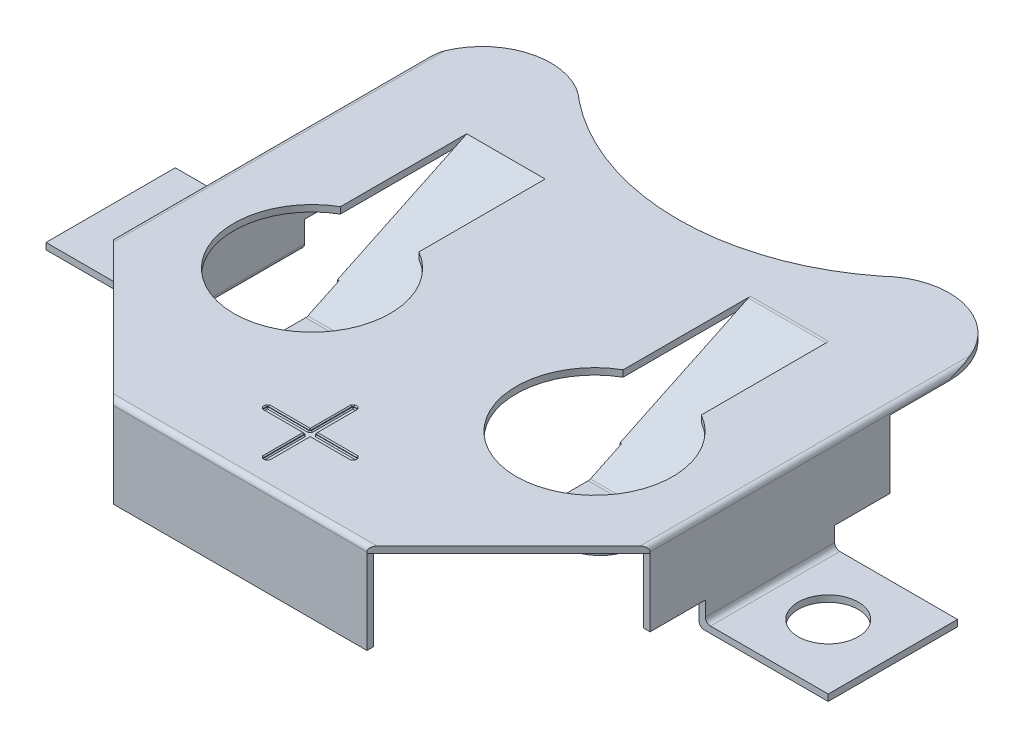
from build123d import *

# Parameters (mm, degrees)
SKETCH1_W        = 5.08
SKETCH1_H        = 5.08
EXTRUDE1_DEPTH   = 0.254
EXTRUDE1_2_DEPTH = 0.254
SKETCH2_R        = 1.1811
EXTRUDE2_DEPTH   = 16.577573784
SKETCH3_W        = 0.254
SKETCH3_H        = 5.08
EXTRUDE3_DEPTH   = 0.7874
SKETCH4_W        = 0.254
SKETCH4_H        = 9.4234
EXTRUDE4_DEPTH   = 2.667
EXTRUDE5_DEPTH   = 0.254
EXTRUDE6_DEPTH   = 0.254
SKETCH7_W        = 9.9568
SKETCH7_H        = 0.254
EXTRUDE7_DEPTH   = 3.302
EXTRUDE8_DEPTH   = 3.0734
EXTRUDE9_START   = -0.254
EXTRUDE9_DEPTH   = 0.859147632
FILLET1_R        = 0.2
FILLET2_R        = 0.2
FILLET3_R        = 0.2
FILLET4_R        = 0.2
FILLET5_R        = 0.2
FILLET6_R        = 0.2
FILLET7_R        = 0.2
FILLET8_R        = 0.2
FILLET9_R        = 0.2
FILLET10_R       = 0.2
FILLET11_R       = 0.2
FILLET12_R       = 0.2
FILLET13_R       = 0.2
FILLET14_R       = 0.2
FILLET15_R       = 0.2
FILLET16_R       = 0.2
FILLET17_R       = 0.2
SKETCH13_W       = 0.2032
SKETCH13_H       = 3.556
SKETCH13_W_2     = 3.556
SKETCH13_H_2     = 0.2032
EXTRUDE10_DEPTH  = 0.1016
CHAMFER1_SIZE    = 0.04


# Read off the part's stored shape, not the designer's step: Extrude9
with BuildPart() as part:
    # Sketch1 → Extrude1 (new body)
    with BuildSketch(Plane(origin=(0, 0, 0), x_dir=(1, 0, 0), z_dir=(0, 1, 0))):
        with Locations((12.827, 0)):
            Rectangle(SKETCH1_W, SKETCH1_H)
    extrude(amount=EXTRUDE1_DEPTH)


with BuildPart() as body_2:
    # Sketch1 → Extrude1 2 (new body)
    with BuildSketch(Plane(origin=(0, 0, 0), x_dir=(1, 0, 0), z_dir=(0, 1, 0))):
        with Locations((-12.827, 0)):
            Rectangle(SKETCH1_W, SKETCH1_H)
    extrude(amount=EXTRUDE1_2_DEPTH)


with BuildPart() as extrude2_tool:
    # Sketch2 → Extrude2 (new, through all)
    with BuildSketch(Plane(origin=(0, 0.254, 0), x_dir=(1, 0, 0), z_dir=(0, 1, 0))):
        with Locations(Location((-12.827, 0, 0), (0, 0, 270))):
            Circle(SKETCH2_R)
        with Locations(Location((12.827, 0, 0), (0, 0, 270))):
            Circle(SKETCH2_R)
    extrude(amount=-EXTRUDE2_DEPTH)


with BuildPart() as part_1:
    add(part.part)

    # Extrude2: cut by extrude2_tool
    add(extrude2_tool.part, mode=Mode.SUBTRACT)



with BuildPart() as body_2_1:
    add(body_2.part)

    # Extrude2: cut by extrude2_tool
    add(extrude2_tool.part, mode=Mode.SUBTRACT)


with BuildPart() as part_2:
    add(part_1.part)

    add(body_2_1.part)  # Extrude3 merges body 2
    # Sketch3 → Extrude3 (add)
    with BuildSketch(Plane(origin=(0, 0.254, 0), x_dir=(1, 0, 0), z_dir=(0, 1, 0))):
        with Locations((-10.414, 0)):
            Rectangle(SKETCH3_W, SKETCH3_H)
        with Locations((10.414, 0)):
            Rectangle(SKETCH3_W, SKETCH3_H)
    extrude(amount=EXTRUDE3_DEPTH)

    # Sketch4 → Extrude4 (add)
    with BuildSketch(Plane(origin=(0, 1.0414, 0), x_dir=(1, 0, 0), z_dir=(0, 1, 0))):
        with Locations((-10.414, 0)):
            Rectangle(SKETCH4_W, SKETCH4_H)
        with Locations((10.414, 0)):
            Rectangle(SKETCH4_W, SKETCH4_H)
    extrude(amount=EXTRUDE4_DEPTH)

    # Sketch5 → Extrude5 (add)
    with BuildSketch(Plane(origin=(0, 3.7084, 0), x_dir=(1, 0, 0), z_dir=(0, 1, 0))):
        with BuildLine():
            Line((-10.541, -4.7117), (-4.9784, -10.2743))
            Line((-4.9784, -10.2743), (4.9784, -10.2743))
            Line((4.9784, -10.2743), (10.541, -4.7117))
            Line((10.541, -4.7117), (10.541, 4.7117))
            Line((10.541, 4.7117), (10.541, 7.081366221))
            ThreePointArc((10.541, 7.081366221), (8.856342037, 9.567471015), (5.904093545, 9.017))
            ThreePointArc((5.904093545, 9.017), (-0.032453227, 6.952785457), (-5.969, 9.017))
            ThreePointArc((-5.969, 9.017), (-8.82572303, 9.595573505), (-10.541, 7.239))
            Line((-10.541, 7.239), (-10.541, 4.7117))
            Line((-10.541, 4.7117), (-10.541, -4.7117))
        make_face()
    extrude(amount=EXTRUDE5_DEPTH)

    # Sketch6 → Extrude6 (cut)
    with BuildSketch(Plane(origin=(0, 3.9624, 0), x_dir=(1, 0, 0), z_dir=(0, 1, 0))):
        with BuildLine():
            Line((-4.0099, 0.754734491), (-4.0099, 5.715))
            Line((-4.0099, 5.715), (-7.0899, 5.715))
            Line((-7.0899, 5.715), (-7.0899, 0.754734491))
            ThreePointArc((-7.0899, 0.754734491), (-5.5499, -4.9784), (-4.0099, 0.754734491))
        make_face()
        with BuildLine():
            Line((7.0866, 5.715), (4.0132, 5.715))
            Line((4.0132, 5.715), (4.0132, 0.756642476))
            ThreePointArc((4.0132, 0.756642476), (5.5499, -4.9784), (7.0866, 0.756642476))
            Line((7.0866, 0.756642476), (7.0866, 5.715))
        make_face()
    extrude(amount=-EXTRUDE6_DEPTH, mode=Mode.SUBTRACT)

    # Sketch7 → Extrude7 (add)
    with BuildSketch(Plane.XZ.offset(-3.7084)):
        with Locations((0, 10.1473)):
            Rectangle(SKETCH7_W, SKETCH7_H)
    extrude(amount=EXTRUDE7_DEPTH)

    # Sketch8 → Extrude8 (add)
    with BuildSketch(Plane(origin=(4.0132, 0, 0), x_dir=(0, 0, -1), z_dir=(1, 0, 0))):
        Polygon((5.715, 3.730661842), (-0.635, 0.682661842), (-3.175, 0.682661842), (-3.175, 0.936661842), (-0.635, 0.936661842), (5.715, 3.9624), align=None)
    extrude8 = extrude(amount=EXTRUDE8_DEPTH)

    # Extrude9 outline → Extrude9 (cut)
    with BuildSketch(Plane(origin=(0, 0.936661842, 0), x_dir=(1, 0, 0), z_dir=(0, 1, 0)).offset(EXTRUDE9_START)):
        with BuildLine():
            Line((4.0132, -3.175), (5.5499, -3.175))
            ThreePointArc((5.5499, -3.175), (4.577375162, -2.813672812), (4.0767, -1.905))
            Line((4.0767, -1.905), (4.0767, 0.635))
            Line((4.0767, 0.635), (4.0132, 0.635))
            Line((4.0132, 0.635), (4.0132, -3.175))
        make_face()
        with BuildLine():
            Line((7.0231, 0.635), (7.0231, -1.905))
            ThreePointArc((7.0231, -1.905), (6.522424838, -2.813672812), (5.5499, -3.175))
            Line((5.5499, -3.175), (7.0866, -3.175))
            Line((7.0866, -3.175), (7.0866, 0.635))
            Line((7.0866, 0.635), (7.0231, 0.635))
        make_face()
    extrude9 = extrude(amount=EXTRUDE9_DEPTH, mode=Mode.SUBTRACT)

    # Mirror1: Extrude8 across plane
    add(extrude8.mirror(Plane(origin=(0, 0, 0), x_dir=(0, 0, 1), z_dir=(1, 0, 0))))

    # Mirror2: Extrude9 across plane
    add(extrude9.mirror(Plane(origin=(0, 0, 0), x_dir=(0, 0, 1), z_dir=(1, 0, 0))), mode=Mode.SUBTRACT)

    # Fillet1
    fillet1_edges = [part_2.edges().sort_by_distance(p)[0] for p in [
        (-10.287, 3.7084, 0),
    ]]
    fillet(fillet1_edges, radius=FILLET1_R)

    # Fillet2
    fillet2_edges = [part_2.edges().sort_by_distance(p)[0] for p in [
        (-5.5499, 0.682661842, 0.635),
    ]]
    fillet(fillet2_edges, radius=FILLET2_R)

    # Fillet3
    fillet3_edges = [part_2.edges().sort_by_distance(p)[0] for p in [
        (-5.5499, 0.936661842, 0.635),
    ]]
    fillet(fillet3_edges, radius=FILLET3_R)

    # Fillet4
    fillet4_edges = [part_2.edges().sort_by_distance(p)[0] for p in [
        (5.5499, 0.682661842, 0.635),
    ]]
    fillet(fillet4_edges, radius=FILLET4_R)

    # Fillet5
    fillet5_edges = [part_2.edges().sort_by_distance(p)[0] for p in [
        (5.5499, 0.936661842, 0.635),
    ]]
    fillet(fillet5_edges, radius=FILLET5_R)

    # Fillet6
    fillet6_edges = [part_2.edges().sort_by_distance(p)[0] for p in [
        (0, 3.7084, 10.0203),
    ]]
    fillet(fillet6_edges, radius=FILLET6_R)

    # Fillet7
    # the kernel refuses this fillet: 0.2 mm, written as the material it takes off along each edge
    with BuildSketch(Plane(origin=(-4.0099, 3.7084, -5.715), x_dir=(0, 0, -1), z_dir=(-1, 0, 0))) as fillet7_piece_1_section:
        with BuildLine():
            CenterArc((FILLET7_R, -FILLET7_R), FILLET7_R, 90, 90)
            Line((0, -FILLET7_R), (0, 0))
            Line((0, 0), (FILLET7_R, 0))
        make_face()
    fillet7_piece_1 = extrude(amount=3.08, mode=Mode.PRIVATE)
    fillet7_piece_1 = split(fillet7_piece_1, bisect_by=Plane(origin=(-4.01155, 3.756367286, -5.768553009), z_dir=(0, -0.9015230574682735, -0.43273106758477137)), keep=Keep.TOP, mode=Mode.PRIVATE)
    fillet7_piece_1 = split(fillet7_piece_1, bisect_by=Plane(origin=(-4.0132, 3.723171149, -5.784487155), z_dir=(1, 0, 0)), keep=Keep.TOP, mode=Mode.PRIVATE)
    add(fillet7_piece_1, mode=Mode.SUBTRACT)
    with BuildSketch(Plane(origin=(-4.0099, 3.7084, -5.715), x_dir=(0, 0, -1), z_dir=(-1, 0, 0))) as fillet7_piece_2_section:
        with BuildLine():
            CenterArc((FILLET7_R, -FILLET7_R), FILLET7_R, 90, 90)
            Line((0, -FILLET7_R), (0, 0))
            Line((0, 0), (FILLET7_R, 0))
        make_face()
    fillet7_piece_2 = extrude(amount=3.08, mode=Mode.PRIVATE)
    fillet7_piece_2 = split(fillet7_piece_2, bisect_by=Plane(origin=(-4.01155, 3.748126007, -5.751383678), z_dir=(0, 0.9015230574682735, 0.43273106758477137)), keep=Keep.TOP, mode=Mode.PRIVATE)
    fillet7_piece_2 = split(fillet7_piece_2, bisect_by=Plane(origin=(-4.0132, 3.790555037, -5.731017744), z_dir=(1, 0, 0)), keep=Keep.TOP, mode=Mode.PRIVATE)
    add(fillet7_piece_2, mode=Mode.SUBTRACT)
    with BuildSketch(Plane(origin=(-4.0099, 3.7084, -5.715), x_dir=(0, 0, -1), z_dir=(-1, 0, 0))) as fillet7_piece_3_section:
        with BuildLine():
            CenterArc((FILLET7_R, -FILLET7_R), FILLET7_R, 90, 90)
            Line((0, -FILLET7_R), (0, 0))
            Line((0, 0), (FILLET7_R, 0))
        make_face()
    fillet7_piece_3 = extrude(amount=3.08, mode=Mode.PRIVATE)
    fillet7_piece_3 = split(fillet7_piece_3, bisect_by=Plane(origin=(-7.0866, 3.723171149, -5.784487155), z_dir=(1, 0, 0)), keep=Keep.TOP, mode=Mode.PRIVATE)
    fillet7_piece_3 = split(fillet7_piece_3, bisect_by=Plane(origin=(-5.5499, 3.756367286, -5.768553009), z_dir=(0, -0.9015230574682735, -0.43273106758477137)), keep=Keep.TOP, mode=Mode.PRIVATE)
    fillet7_piece_3 = split(fillet7_piece_3, bisect_by=Plane(origin=(-4.0132, 3.723171149, -5.784487155), z_dir=(-1, 0, 0)), keep=Keep.TOP, mode=Mode.PRIVATE)
    add(fillet7_piece_3, mode=Mode.SUBTRACT)
    with BuildSketch(Plane(origin=(-4.0099, 3.7084, -5.715), x_dir=(0, 0, -1), z_dir=(-1, 0, 0))) as fillet7_piece_4_section:
        with BuildLine():
            CenterArc((FILLET7_R, -FILLET7_R), FILLET7_R, 90, 90)
            Line((0, -FILLET7_R), (0, 0))
            Line((0, 0), (FILLET7_R, 0))
        make_face()
    fillet7_piece_4 = extrude(amount=3.08, mode=Mode.PRIVATE)
    fillet7_piece_4 = split(fillet7_piece_4, bisect_by=Plane(origin=(-7.0866, 3.723171149, -5.784487155), z_dir=(-1, 0, 0)), keep=Keep.TOP, mode=Mode.PRIVATE)
    fillet7_piece_4 = split(fillet7_piece_4, bisect_by=Plane(origin=(-7.08825, 3.756367286, -5.768553009), z_dir=(0, -0.9015230574682735, -0.43273106758477137)), keep=Keep.TOP, mode=Mode.PRIVATE)
    add(fillet7_piece_4, mode=Mode.SUBTRACT)
    with BuildSketch(Plane(origin=(-4.0099, 3.7084, -5.715), x_dir=(0, 0, -1), z_dir=(-1, 0, 0))) as fillet7_piece_5_section:
        with BuildLine():
            CenterArc((FILLET7_R, -FILLET7_R), FILLET7_R, 90, 90)
            Line((0, -FILLET7_R), (0, 0))
            Line((0, 0), (FILLET7_R, 0))
        make_face()
    fillet7_piece_5 = extrude(amount=3.08, mode=Mode.PRIVATE)
    fillet7_piece_5 = split(fillet7_piece_5, bisect_by=Plane(origin=(-7.0866, 3.790555037, -5.731017744), z_dir=(-1, 0, 0)), keep=Keep.TOP, mode=Mode.PRIVATE)
    fillet7_piece_5 = split(fillet7_piece_5, bisect_by=Plane(origin=(-7.08825, 3.748126007, -5.751383678), z_dir=(0, 0.9015230574682735, 0.43273106758477137)), keep=Keep.TOP, mode=Mode.PRIVATE)
    add(fillet7_piece_5, mode=Mode.SUBTRACT)

    # Fillet8
    fillet8_edges = [part_2.edges().sort_by_distance(p)[0] for p in [
        (0, 3.9624, 10.2743),
    ]]
    fillet(fillet8_edges, radius=FILLET8_R)

    # Fillet9
    # the kernel refuses this fillet: 0.2 mm, written as the material it takes off along each edge
    with BuildSketch(Plane(origin=(7.0866, 3.7084, -5.715), x_dir=(0, 0, -1), z_dir=(-1, 0, 0))) as fillet9_piece_1:
        with BuildLine():
            CenterArc((0.091701402, -0.2), FILLET9_R, 90, 27.290809521)
            Line((0, -0.022261842), (-0.001834028, -0.018707079))
            ThreePointArc((-0.001834028, -0.018707079), (-0.004, -0.011130921), (-0.004, 0))
            Line((-0.004, 0), (0, 0.004))
            Line((0, 0.004), (0.091701402, 0.004))
            Line((0.091701402, 0.004), (0.091701402, 0))
        make_face()
    extrude(amount=3.0734, mode=Mode.SUBTRACT)

    # Fillet10
    fillet10_edges = [part_2.edges().sort_by_distance(p)[0] for p in [
        (5.5499, 3.9624, -5.715),
    ]]
    fillet(fillet10_edges, radius=FILLET10_R)

    # Fillet11
    # the kernel refuses this fillet: 0.2 mm, written as the material it takes off along each edge
    with BuildSketch(Plane(origin=(10.541, 3.9624, -8.281366221), x_dir=(-1, 0, 0), z_dir=(0, 0, 1))) as fillet11_piece_1:
        with BuildLine():
            CenterArc((FILLET11_R, FILLET11_R), FILLET11_R, 180, 90)
            Line((0, FILLET11_R), (-FILLET11_R * 0.02, FILLET11_R))
            Line((-FILLET11_R * 0.02, FILLET11_R), (-FILLET11_R * 0.02, -FILLET11_R * 0.02))
            Line((-FILLET11_R * 0.02, -FILLET11_R * 0.02), (FILLET11_R, -FILLET11_R * 0.02))
            Line((FILLET11_R, -FILLET11_R * 0.02), (FILLET11_R, 0))
        make_face()
    extrude(amount=14.193066221, mode=Mode.SUBTRACT)

    # Fillet12
    fillet12_edges = [part_2.edges().sort_by_distance(p)[0] for p in [
        (-10.541, 0.254, 0),
    ]]
    fillet(fillet12_edges, radius=FILLET12_R)

    # Fillet13
    fillet13_edges = [part_2.edges().sort_by_distance(p)[0] for p in [
        (10.287, 3.7084, 0),
    ]]
    fillet(fillet13_edges, radius=FILLET13_R)

    # Fillet14
    fillet14_edges = [part_2.edges().sort_by_distance(p)[0] for p in [
        (10.541, 0.254, 0),
    ]]
    fillet(fillet14_edges, radius=FILLET14_R)

    # Fillet15
    fillet15_edges = [part_2.edges().sort_by_distance(p)[0] for p in [
        (-10.287, 0, 0),
    ]]
    fillet(fillet15_edges, radius=FILLET15_R)

    # Fillet16
    fillet16_edges = [part_2.edges().sort_by_distance(p)[0] for p in [
        (10.287, 0, 0),
    ]]
    fillet(fillet16_edges, radius=FILLET16_R)

    # Fillet17
    # the kernel refuses this fillet: 0.2 mm, written as the material it takes off along each edge
    with BuildSketch(Plane(origin=(-10.541, 3.9624, 5.9117), x_dir=(0, -1, 0), z_dir=(0, 0, -1))) as fillet17_piece_1:
        with BuildLine():
            CenterArc((FILLET17_R, -FILLET17_R), FILLET17_R, 90, 90)
            Line((0, -FILLET17_R), (-FILLET17_R * 0.02, -FILLET17_R))
            Line((-FILLET17_R * 0.02, -FILLET17_R), (-FILLET17_R * 0.02, FILLET17_R * 0.02))
            Line((-FILLET17_R * 0.02, FILLET17_R * 0.02), (FILLET17_R, FILLET17_R * 0.02))
            Line((FILLET17_R, FILLET17_R * 0.02), (FILLET17_R, 0))
        make_face()
    extrude(amount=14.3507, mode=Mode.SUBTRACT)

    # Sketch13 → Extrude10 (cut)
    with BuildSketch(Plane(origin=(0, 3.9624, 0), x_dir=(1, 0, 0), z_dir=(0, 1, 0))):
        with Locations((0, -7.5243)):
            Rectangle(SKETCH13_W, SKETCH13_H)
        with Locations((0, -7.5243)):
            Rectangle(SKETCH13_W_2, SKETCH13_H_2)
    extrude(amount=-EXTRUDE10_DEPTH, mode=Mode.SUBTRACT)

    # Chamfer1
    chamfer1_edges = [part_2.edges().sort_by_distance(p)[0] for p in [
        (0, 3.8608, 9.3023),
        (0.1016, 3.9116, 9.3023),
        (-0.1016, 3.8608, 8.4641),
        (-0.1016, 3.9116, 9.3023),
        (0.1016, 3.9116, 7.6259),
        (0.1016, 3.9624, 8.4641),
        (0.9398, 3.9624, 7.6259),
        (1.778, 3.9624, 7.5243),
        (-0.1016, 3.9624, 6.5845),
        (-0.9398, 3.9624, 7.6259),
        (-0.1016, 3.9624, 8.4641),
        (0, 3.9624, 9.3023),
        (-1.778, 3.8608, 7.5243),
        (-0.9398, 3.8608, 7.4227),
        (0, 3.8608, 5.7463),
        (0.1016, 3.8608, 6.5845),
        (0.9398, 3.8608, 7.4227),
        (0.1016, 3.8608, 8.4641),
        (-0.1016, 3.8608, 6.5845),
        (-0.1016, 3.9116, 7.4227),
        (0, 3.9624, 5.7463),
        (-0.1016, 3.9116, 5.7463),
        (0.1016, 3.9116, 5.7463),
        (0.1016, 3.9624, 6.5845),
        (-0.9398, 3.8608, 7.6259),
        (-0.1016, 3.9116, 7.6259),
        (-1.778, 3.9624, 7.5243),
        (-1.778, 3.9116, 7.6259),
        (-1.778, 3.9116, 7.4227),
        (-0.9398, 3.9624, 7.4227),
        (1.778, 3.8608, 7.5243),
        (1.778, 3.9116, 7.4227),
        (0.9398, 3.8608, 7.6259),
        (1.778, 3.9116, 7.6259),
        (0.1016, 3.9116, 7.4227),
        (0.9398, 3.9624, 7.4227),
    ]]
    chamfer(chamfer1_edges, length=CHAMFER1_SIZE)


solid = part_2.part
